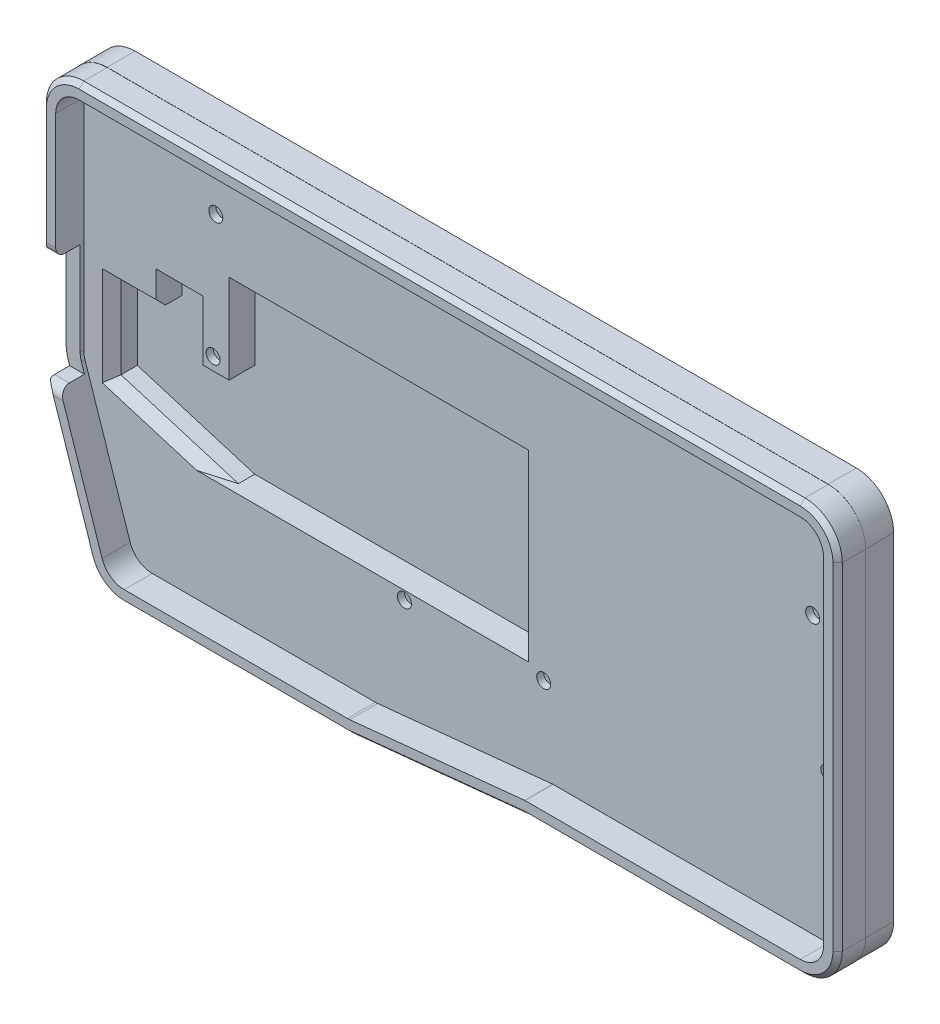
from build123d import *

# Parameters (mm, degrees)
BOSS_EXTRUDE1_DEPTH = 6
SKETCH4_R           = 1
BOSS_EXTRUDE2_DEPTH = 6
CUT_EXTRUDE2_DEPTH  = 5.5
BOSS_EXTRUDE3_START = -5.5
SKETCH6_R           = 1
BOSS_EXTRUDE3_DEPTH = 5.5
SKETCH7_R           = 1.5
CUT_EXTRUDE3_DEPTH  = 1.5
SKETCH8_R           = 6
CUT_EXTRUDE4_DEPTH  = 2.5
CHAMFER1_SIZE       = 1
SKETCH10_W          = 6.694305889
SKETCH10_H          = 23.548708483
CUT_EXTRUDE6_DEPTH  = 5
FILLET2_R           = 2
SKETCH11_W          = 9.997758807
SKETCH11_H          = 15.961334235
CUT_EXTRUDE7_DEPTH  = 5.5
SKETCH12_W          = 64.020736218
SKETCH12_H          = 3.376126478
BOSS_EXTRUDE4_DEPTH = 5.5
CUT_EXTRUDE8_DEPTH  = 5.5
CHAMFER2_SIZE       = 2
CHAMFER3_SIZE       = 2
CHAMFER4_SIZE       = 2


with BuildPart() as part:
    # Sketch3 → Boss-Extrude1 (new body)
    with BuildSketch(Plane.XY):
        with BuildLine():
            Line((-83.698447841, 57.444573542), (70.551552159, 57.348317742))
            ThreePointArc((70.551552159, 57.348317742), (76.205179029, 55.0034083), (78.546560098, 49.348319285))
            Line((78.546560098, 49.348319285), (78.546560098, -22.653552215))
            ThreePointArc((78.546560098, -22.653552215), (76.203414347, -28.310406464), (70.546560098, -30.653552215))
            Line((70.546560098, -30.653552215), (11.797913198, -30.653552215))
            Line((11.797913198, -30.653552215), (-25.501951002, -34.413220215))
            ThreePointArc((-25.501951002, -34.413220215), (-25.902594791, -34.443462903), (-26.304251697, -34.453552282))
            Line((-26.304251697, -34.453552282), (-74.041162197, -34.453552282))
            ThreePointArc((-74.041162197, -34.453552282), (-78.718844372, -32.943489837), (-81.6306285, -28.983374648))
            Line((-81.6306285, -28.983374648), (-91.292906294, 0.003458516))
            ThreePointArc((-91.292906294, 0.003458516), (-91.600139587, 1.251822731), (-91.703439931, 2.53328071))
            Line((-91.703439931, 2.53328071), (-91.703439931, 49.44457511))
            ThreePointArc((-91.703439931, 49.44457511), (-89.358528934, 55.103194051), (-83.698447841, 57.444573542))
        make_face()
        with BuildLine():
            Line((-83.700319941, 54.444574123), (70.549680059, 54.348318323))
            ThreePointArc((70.549680059, 54.348318323), (74.083196904, 52.882749939), (75.546560095, 49.348319271))
            Line((75.546560095, 49.348319271), (75.546560095, -22.653552229))
            ThreePointArc((75.546560095, -22.653552229), (74.082093996, -26.189086124), (70.546560098, -27.653552212))
            Line((70.546560098, -27.653552212), (11.697371898, -27.653552212))
            ThreePointArc((11.697371898, -27.653552212), (11.64716478, -27.654813402), (11.597084303, -27.658593757))
            Line((11.597084303, -27.658593757), (-25.802813799, -31.428344747))
            ThreePointArc((-25.802813799, -31.428344747), (-26.053216149, -31.447246424), (-26.304251697, -31.453552285))
            Line((-26.304251697, -31.453552285), (-74.041162197, -31.453552285))
            ThreePointArc((-74.041162197, -31.453552285), (-76.964713558, -30.509763257), (-78.784578638, -28.034691263))
            Line((-78.784578638, -28.034691263), (-88.446856397, 0.952141815))
            ThreePointArc((-88.446856397, 0.952141815), (-88.638877211, 1.732369461), (-88.703439928, 2.53328071))
            Line((-88.703439928, 2.53328071), (-88.703439928, 49.44457511))
            ThreePointArc((-88.703439928, 49.44457511), (-87.237870579, 52.981211921), (-83.700319941, 54.444574123))
        make_face(mode=Mode.SUBTRACT)
    extrude(amount=BOSS_EXTRUDE1_DEPTH)

    # Sketch4 → Boss-Extrude2 (add)
    with BuildSketch(Plane.XY):
        with BuildLine():
            Line((70.540879127, 57.382899954), (-83.709120873, 57.479155754))
            ThreePointArc((-83.709120873, 57.479155754), (-89.369201966, 55.137776263), (-91.714112963, 49.479157322))
            Line((-91.714112963, 49.479157322), (-91.714112963, 2.567862922))
            ThreePointArc((-91.714112963, 2.567862922), (-91.610812619, 1.286404943), (-91.303579326, 0.038040728))
            Line((-91.303579326, 0.038040728), (-81.641301532, -28.948792436))
            ThreePointArc((-81.641301532, -28.948792436), (-78.729517404, -32.908907625), (-74.051835229, -34.41897007))
            Line((-74.051835229, -34.41897007), (-26.314924729, -34.41897007))
            ThreePointArc((-26.314924729, -34.41897007), (-25.913267823, -34.408880691), (-25.512624034, -34.378638003))
            Line((-25.512624034, -34.378638003), (11.787240166, -30.618970003))
            Line((11.787240166, -30.618970003), (70.535887066, -30.618970003))
            ThreePointArc((70.535887066, -30.618970003), (76.192741315, -28.275824252), (78.535887066, -22.618970003))
            Line((78.535887066, -22.618970003), (78.535887066, 49.382901497))
            ThreePointArc((78.535887066, 49.382901497), (76.194505997, 55.037990512), (70.540879127, 57.382899954))
        make_face()
        with Locations((-60.464112963, 41.881029922)):
            Circle(SKETCH4_R, mode=Mode.SUBTRACT)
        with Locations((67.215887037, 31.431029922)):
            Circle(SKETCH4_R, mode=Mode.SUBTRACT)
        with Locations((-20.114112963, -9.418970078)):
            Circle(SKETCH4_R, mode=Mode.SUBTRACT)
        with Locations((9.685887037, -9.418970078)):
            Circle(SKETCH4_R, mode=Mode.SUBTRACT)
        with Locations((70.485887037, 3.881029922)):
            Circle(SKETCH4_R, mode=Mode.SUBTRACT)
        with Locations((-61.034112963, 15.281029922)):
            Circle(SKETCH4_R, mode=Mode.SUBTRACT)
    extrude(amount=-BOSS_EXTRUDE2_DEPTH)

    # Sketch5 → Cut-Extrude2 (cut)
    with BuildSketch(Plane.XY):
        Polygon((6.395770088, 35.016305674), (-57.62496613, 35.016305674), (-57.62496613, 12.565198178), (-76.041890248, 12.565198178), (-76.041890248, -1.642143284), (-57.62496613, -1.642143284), (-57.62496613, -7.605718712), (6.395770088, -7.605718712), align=None)
    extrude(amount=-CUT_EXTRUDE2_DEPTH, mode=Mode.SUBTRACT)

    # Sketch6 → Boss-Extrude3 (add)
    with BuildSketch(Plane(origin=(0, 0, -6), x_dir=(-1, 0, 0), z_dir=(0, 0, -1)).offset(BOSS_EXTRUDE3_START)):
        with Locations((-67.215887037, 31.431029922)):
            Circle(SKETCH6_R)
        with Locations((-70.485887037, 3.881029922)):
            Circle(SKETCH6_R)
        with Locations((-9.685887037, -9.418970078)):
            Circle(SKETCH6_R)
        with Locations((20.114112963, -9.418970078)):
            Circle(SKETCH6_R)
        with Locations((61.034112963, 15.281029922)):
            Circle(SKETCH6_R)
        with Locations((60.464112963, 41.881029922)):
            Circle(SKETCH6_R)
    extrude(amount=BOSS_EXTRUDE3_DEPTH)

    # Sketch7 → Cut-Extrude3 (cut)
    with BuildSketch(Plane.XY):
        with Locations((-60.464112963, 41.881029922)):
            Circle(SKETCH7_R)
        with Locations((-61.034112963, 15.281029922)):
            Circle(SKETCH7_R)
        with Locations((-20.114112963, -9.418970078)):
            Circle(SKETCH7_R)
        with Locations((9.685887037, -9.418970078)):
            Circle(SKETCH7_R)
        with Locations((70.485887037, 3.881029922)):
            Circle(SKETCH7_R)
        with Locations((67.215887037, 31.431029922)):
            Circle(SKETCH7_R)
    extrude(amount=-CUT_EXTRUDE3_DEPTH, mode=Mode.SUBTRACT)

    # Sketch8 → Cut-Extrude4 (cut)
    with BuildSketch(Plane(origin=(0, 0, -6), x_dir=(-1, 0, 0), z_dir=(0, 0, -1))):
        with Locations((-70.535887037, 49.382901483)):
            Circle(SKETCH8_R)
        with Locations((73.586300366, -25.671844276)):
            Circle(SKETCH8_R)
        with Locations((-70.535887037, -22.163858729)):
            Circle(SKETCH8_R)
        with Locations((83.75945845, 49.382901483)):
            Circle(SKETCH8_R)
    extrude(amount=-CUT_EXTRUDE4_DEPTH, mode=Mode.SUBTRACT)

    # Chamfer1
    chamfer1_edges = [part.edges().sort_by_distance(p)[0] for p in [
        (-78.718844372, -32.943489837, 6),
        (-86.461767397, -14.489958066, 6),
        (-91.600139587, 1.251822731, 6),
        (-91.703439931, 25.98892791, 6),
        (-89.358528934, 55.103194051, 6),
        (-6.573447841, 57.396445642, 6),
        (76.205179029, 55.0034083, 6),
        (78.546560098, 13.347383535, 6),
        (76.203414347, -28.310406464, 6),
        (41.172236648, -30.653552215, 6),
        (-6.852018902, -32.533386215, 6),
        (-25.902594791, -34.443462903, 6),
        (-50.172706947, -34.453552282, 6),
    ]]
    chamfer(chamfer1_edges, length=CHAMFER1_SIZE)

    # Sketch10 → Cut-Extrude6 (cut)
    with BuildSketch(Plane.ZY.offset(91.703439931)):
        with Locations((4.11441559, 10.748748776)):
            Rectangle(SKETCH10_W, SKETCH10_H)
    extrude(amount=-CUT_EXTRUDE6_DEPTH, mode=Mode.SUBTRACT)

    # Fillet2
    fillet2_edges = [part.edges().sort_by_distance(p)[0] for p in [
        (-88.841699855, -1.025605466, 6),
        (-89.703439929, 22.523103017, 6),
    ]]
    fillet(fillet2_edges, radius=FILLET2_R)

    # Sketch11 → Cut-Extrude7 (cut)
    with BuildSketch(Plane.XY):
        with Locations((-68.236622408, 17.388678305)):
            Rectangle(SKETCH11_W, SKETCH11_H)
    extrude(amount=-CUT_EXTRUDE7_DEPTH, mode=Mode.SUBTRACT)

    # Sketch12 → Boss-Extrude4 (add)
    with BuildSketch(Plane.XY.offset(-5.5)):
        with Locations((-25.614598021, 33.328242435)):
            Rectangle(SKETCH12_W, SKETCH12_H)
    extrude(amount=BOSS_EXTRUDE4_DEPTH)

    # Sketch13 → Cut-Extrude8 (cut)
    with BuildSketch(Plane.XY):
        Polygon((-82.744925302, 17.678852462), (-82.744925302, 0), (-57.62496613, -7.605718712), (-57.62496613, -1.642143284), (-76.041890248, -1.642143284), (-76.041890248, 12.565198178), (-73.235501811, 12.565198178), (-73.235501811, 17.678852462), align=None)
    extrude(amount=-CUT_EXTRUDE8_DEPTH, mode=Mode.SUBTRACT)

    # Chamfer2
    chamfer2_edges = [part.edges().sort_by_distance(p)[0] for p in [
        (-82.744925302, 8.839426231, 0),
    ]]
    chamfer(chamfer2_edges, length=CHAMFER2_SIZE)

    # Chamfer3
    chamfer3_edges = [part.edges().sort_by_distance(p)[0] for p in [
        (-78.990213556, 17.678852462, 0),
    ]]
    chamfer(chamfer3_edges, length=CHAMFER3_SIZE)

    # Chamfer4
    chamfer4_edges = [part.edges().sort_by_distance(p)[0] for p in [
        (-71.184945716, -3.500083438, 0),
    ]]
    chamfer(chamfer4_edges, length=CHAMFER4_SIZE)


solid = part.part
